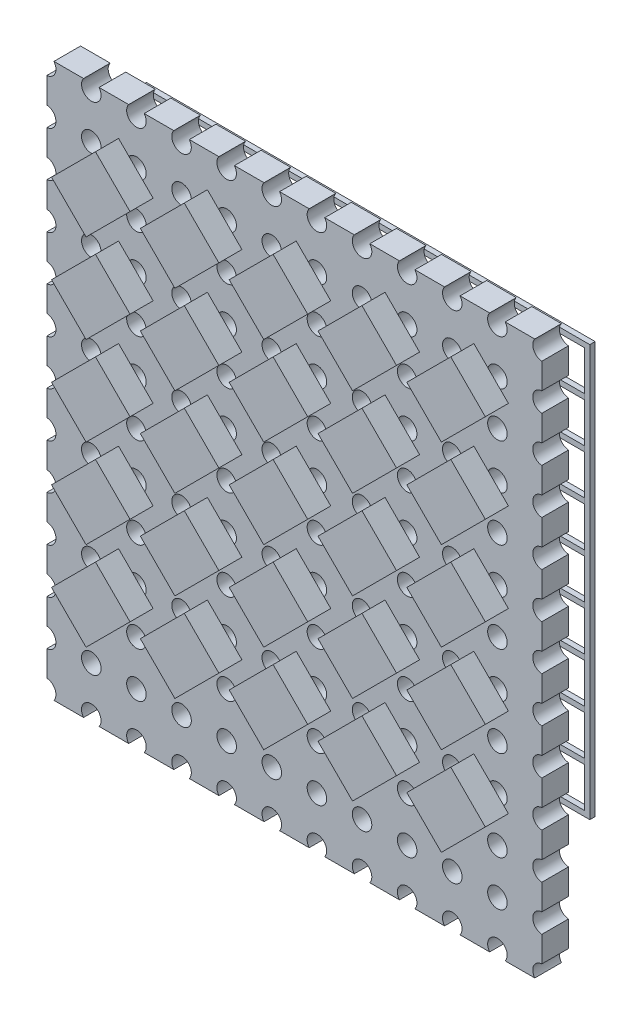
from build123d import *

# Parameters (mm, degrees)
SKETCH1_W               = 27.86
SKETCH1_H               = 31.15
BOSS_EXTRUDE1_DEPTH     = 1.5
FILL_PATTERN1_OUTLINE_R = 0.55
FILL_PATTERN1_DEPTH     = 1.5
BOSS_EXTRUDE2_DEPTH     = 1.3
LPATTERN2_COUNT         = 5
LPATTERN2_PITCH         = 5
LPATTERN2_COUNT_DIR2    = 5
LPATTERN2_PITCH_DIR2    = 5
SKETCH6_W               = 25.26
SKETCH6_H               = 23.16
SKETCH6_W_2             = 24.66
SKETCH6_H_2             = 22.56
EXTRUDE_THIN1_DEPTH     = 0.3
SKETCH6_W_3             = 24.96
SKETCH6_H_3             = 0.3
EXTRUDE_THIN1_2_DEPTH   = 0.3
EXTRUDE_THIN1_3_DEPTH   = 0.3
EXTRUDE_THIN1_4_DEPTH   = 0.3
EXTRUDE_THIN1_5_DEPTH   = 0.3
EXTRUDE_THIN1_6_DEPTH   = 0.3
EXTRUDE_THIN1_7_DEPTH   = 0.3
EXTRUDE_THIN1_8_DEPTH   = 0.3
EXTRUDE_THIN1_9_DEPTH   = 0.3


# Read off the part's stored shape, not the designer's step: Fill Pattern1
with BuildPart() as part:
    # Sketch1 → Boss-Extrude1 (new body)
    with BuildSketch(Plane.XY):
        Rectangle(SKETCH1_W, SKETCH1_H)
    extrude(amount=BOSS_EXTRUDE1_DEPTH)

    # Fill Pattern1 outline → Fill Pattern1 (cut)
    with BuildSketch(Plane.XY):
        with Locations((1.27, 0)):
            Circle(FILL_PATTERN1_OUTLINE_R)
        with Locations((-11.43, 2.54)):
            Circle(FILL_PATTERN1_OUTLINE_R)
        with BuildLine():
            ThreePointArc((-9.326205227, 15.575), (-8.89, 14.69), (-8.453794773, 15.575))
            Line((-8.453794773, 15.575), (-9.326205227, 15.575))
        make_face()
        with BuildLine():
            Line((-5.913794773, 15.575), (-6.786205227, 15.575))
            ThreePointArc((-6.786205227, 15.575), (-6.35, 14.69), (-5.913794773, 15.575))
        make_face()
        with BuildLine():
            ThreePointArc((-11.866205227, 15.575), (-11.43, 14.69), (-10.993794773, 15.575))
            Line((-10.993794773, 15.575), (-11.866205227, 15.575))
        make_face()
        with BuildLine():
            Line((-3.373794773, 15.575), (-4.246205227, 15.575))
            ThreePointArc((-4.246205227, 15.575), (-3.81, 14.69), (-3.373794773, 15.575))
        make_face()
        with BuildLine():
            ThreePointArc((-13.93, 14.691456474), (-13.468148284, 15.014955883), (-13.533794773, 15.575))
            Line((-13.533794773, 15.575), (-13.93, 15.575))
            Line((-13.93, 15.575), (-13.93, 14.691456474))
        make_face()
        with BuildLine():
            Line((-0.833794773, 15.575), (-1.706205227, 15.575))
            ThreePointArc((-1.706205227, 15.575), (-1.27, 14.69), (-0.833794773, 15.575))
        make_face()
        with BuildLine():
            ThreePointArc((-13.93, 12.151456474), (-13.42, 12.7), (-13.93, 13.248543526))
            Line((-13.93, 13.248543526), (-13.93, 12.151456474))
        make_face()
        with BuildLine():
            Line((1.706205227, 15.575), (0.833794773, 15.575))
            ThreePointArc((0.833794773, 15.575), (1.27, 14.69), (1.706205227, 15.575))
        make_face()
        with BuildLine():
            ThreePointArc((-13.93, 9.611456474), (-13.42, 10.16), (-13.93, 10.708543526))
            Line((-13.93, 10.708543526), (-13.93, 9.611456474))
        make_face()
        with BuildLine():
            Line((4.246205227, 15.575), (3.373794773, 15.575))
            ThreePointArc((3.373794773, 15.575), (3.81, 14.69), (4.246205227, 15.575))
        make_face()
        with BuildLine():
            ThreePointArc((-13.93, 7.071456474), (-13.42, 7.62), (-13.93, 8.168543526))
            Line((-13.93, 8.168543526), (-13.93, 7.071456474))
        make_face()
        with BuildLine():
            Line((6.786205227, 15.575), (5.913794773, 15.575))
            ThreePointArc((5.913794773, 15.575), (6.35, 14.69), (6.786205227, 15.575))
        make_face()
        with BuildLine():
            ThreePointArc((-13.93, 4.531456474), (-13.42, 5.08), (-13.93, 5.628543526))
            Line((-13.93, 5.628543526), (-13.93, 4.531456474))
        make_face()
        with BuildLine():
            Line((9.326205227, 15.575), (8.453794773, 15.575))
            ThreePointArc((8.453794773, 15.575), (8.89, 14.69), (9.326205227, 15.575))
        make_face()
        with BuildLine():
            ThreePointArc((-13.93, 1.991456474), (-13.42, 2.54), (-13.93, 3.088543526))
            Line((-13.93, 3.088543526), (-13.93, 1.991456474))
        make_face()
        with BuildLine():
            Line((11.866205227, 15.575), (10.993794773, 15.575))
            ThreePointArc((10.993794773, 15.575), (11.43, 14.69), (11.866205227, 15.575))
        make_face()
        with BuildLine():
            ThreePointArc((-13.93, -0.548543526), (-13.42, 0), (-13.93, 0.548543526))
            Line((-13.93, 0.548543526), (-13.93, -0.548543526))
        make_face()
        with BuildLine():
            Line((13.93, 15.575), (13.533794773, 15.575))
            ThreePointArc((13.533794773, 15.575), (13.468148284, 15.014955883), (13.93, 14.691456474))
            Line((13.93, 14.691456474), (13.93, 15.575))
        make_face()
        with BuildLine():
            ThreePointArc((-13.93, -3.088543526), (-13.42, -2.54), (-13.93, -1.991456474))
            Line((-13.93, -1.991456474), (-13.93, -3.088543526))
        make_face()
        with BuildLine():
            Line((13.93, 12.151456474), (13.93, 13.248543526))
            ThreePointArc((13.93, 13.248543526), (13.42, 12.7), (13.93, 12.151456474))
        make_face()
        with BuildLine():
            ThreePointArc((-13.93, -5.628543526), (-13.42, -5.08), (-13.93, -4.531456474))
            Line((-13.93, -4.531456474), (-13.93, -5.628543526))
        make_face()
        with BuildLine():
            Line((13.93, 9.611456474), (13.93, 10.708543526))
            ThreePointArc((13.93, 10.708543526), (13.42, 10.16), (13.93, 9.611456474))
        make_face()
        with BuildLine():
            ThreePointArc((-13.93, -8.168543526), (-13.42, -7.62), (-13.93, -7.071456474))
            Line((-13.93, -7.071456474), (-13.93, -8.168543526))
        make_face()
        with BuildLine():
            Line((13.93, 7.071456474), (13.93, 8.168543526))
            ThreePointArc((13.93, 8.168543526), (13.42, 7.62), (13.93, 7.071456474))
        make_face()
        with BuildLine():
            ThreePointArc((-13.93, -10.708543526), (-13.42, -10.16), (-13.93, -9.611456474))
            Line((-13.93, -9.611456474), (-13.93, -10.708543526))
        make_face()
        with BuildLine():
            Line((13.93, 4.531456474), (13.93, 5.628543526))
            ThreePointArc((13.93, 5.628543526), (13.42, 5.08), (13.93, 4.531456474))
        make_face()
        with BuildLine():
            ThreePointArc((-13.93, -13.248543526), (-13.42, -12.7), (-13.93, -12.151456474))
            Line((-13.93, -12.151456474), (-13.93, -13.248543526))
        make_face()
        with BuildLine():
            Line((13.93, 1.991456474), (13.93, 3.088543526))
            ThreePointArc((13.93, 3.088543526), (13.42, 2.54), (13.93, 1.991456474))
        make_face()
        with BuildLine():
            ThreePointArc((-13.533794773, -15.575), (-13.468148284, -15.014955883), (-13.93, -14.691456474))
            Line((-13.93, -14.691456474), (-13.93, -15.575))
            Line((-13.93, -15.575), (-13.533794773, -15.575))
        make_face()
        with BuildLine():
            Line((13.93, -0.548543526), (13.93, 0.548543526))
            ThreePointArc((13.93, 0.548543526), (13.42, 0), (13.93, -0.548543526))
        make_face()
        with BuildLine():
            ThreePointArc((-10.993794773, -15.575), (-11.43, -14.69), (-11.866205227, -15.575))
            Line((-11.866205227, -15.575), (-10.993794773, -15.575))
        make_face()
        with BuildLine():
            Line((13.93, -3.088543526), (13.93, -1.991456474))
            ThreePointArc((13.93, -1.991456474), (13.42, -2.54), (13.93, -3.088543526))
        make_face()
        with BuildLine():
            ThreePointArc((-8.453794773, -15.575), (-8.89, -14.69), (-9.326205227, -15.575))
            Line((-9.326205227, -15.575), (-8.453794773, -15.575))
        make_face()
        with BuildLine():
            Line((13.93, -5.628543526), (13.93, -4.531456474))
            ThreePointArc((13.93, -4.531456474), (13.42, -5.08), (13.93, -5.628543526))
        make_face()
        with BuildLine():
            ThreePointArc((-5.913794773, -15.575), (-6.35, -14.69), (-6.786205227, -15.575))
            Line((-6.786205227, -15.575), (-5.913794773, -15.575))
        make_face()
        with BuildLine():
            Line((13.93, -8.168543526), (13.93, -7.071456474))
            ThreePointArc((13.93, -7.071456474), (13.42, -7.62), (13.93, -8.168543526))
        make_face()
        with BuildLine():
            ThreePointArc((-3.373794773, -15.575), (-3.81, -14.69), (-4.246205227, -15.575))
            Line((-4.246205227, -15.575), (-3.373794773, -15.575))
        make_face()
        with BuildLine():
            Line((13.93, -10.708543526), (13.93, -9.611456474))
            ThreePointArc((13.93, -9.611456474), (13.42, -10.16), (13.93, -10.708543526))
        make_face()
        with BuildLine():
            ThreePointArc((-0.833794773, -15.575), (-1.27, -14.69), (-1.706205227, -15.575))
            Line((-1.706205227, -15.575), (-0.833794773, -15.575))
        make_face()
        with BuildLine():
            Line((13.93, -13.248543526), (13.93, -12.151456474))
            ThreePointArc((13.93, -12.151456474), (13.42, -12.7), (13.93, -13.248543526))
        make_face()
        with BuildLine():
            ThreePointArc((1.706205227, -15.575), (1.27, -14.69), (0.833794773, -15.575))
            Line((0.833794773, -15.575), (1.706205227, -15.575))
        make_face()
        with BuildLine():
            Line((13.93, -15.575), (13.93, -14.691456474))
            ThreePointArc((13.93, -14.691456474), (13.468148284, -15.014955883), (13.533794773, -15.575))
            Line((13.533794773, -15.575), (13.93, -15.575))
        make_face()
        with BuildLine():
            ThreePointArc((4.246205227, -15.575), (3.81, -14.69), (3.373794773, -15.575))
            Line((3.373794773, -15.575), (4.246205227, -15.575))
        make_face()
        with BuildLine():
            Line((10.993794773, -15.575), (11.866205227, -15.575))
            ThreePointArc((11.866205227, -15.575), (11.43, -14.69), (10.993794773, -15.575))
        make_face()
        with BuildLine():
            ThreePointArc((6.786205227, -15.575), (6.35, -14.69), (5.913794773, -15.575))
            Line((5.913794773, -15.575), (6.786205227, -15.575))
        make_face()
        with BuildLine():
            Line((8.453794773, -15.575), (9.326205227, -15.575))
            ThreePointArc((9.326205227, -15.575), (8.89, -14.69), (8.453794773, -15.575))
        make_face()
        with Locations((-11.43, 0)):
            Circle(FILL_PATTERN1_OUTLINE_R)
        with Locations((-11.43, 7.62)):
            Circle(FILL_PATTERN1_OUTLINE_R)
        with Locations((-11.43, 5.08)):
            Circle(FILL_PATTERN1_OUTLINE_R)
        with Locations((-11.43, -7.62)):
            Circle(FILL_PATTERN1_OUTLINE_R)
        with Locations((-11.43, -10.16)):
            Circle(FILL_PATTERN1_OUTLINE_R)
        with Locations((-11.43, -2.54)):
            Circle(FILL_PATTERN1_OUTLINE_R)
        with Locations((-11.43, -5.08)):
            Circle(FILL_PATTERN1_OUTLINE_R)
        with Locations((-8.89, 0)):
            Circle(FILL_PATTERN1_OUTLINE_R)
        with Locations((-6.35, 12.7)):
            Circle(FILL_PATTERN1_OUTLINE_R)
        with Locations((-8.89, -2.54)):
            Circle(FILL_PATTERN1_OUTLINE_R)
        with Locations((-8.89, 2.54)):
            Circle(FILL_PATTERN1_OUTLINE_R)
        with Locations((-3.81, 12.7)):
            Circle(FILL_PATTERN1_OUTLINE_R)
        with Locations((-8.89, -7.62)):
            Circle(FILL_PATTERN1_OUTLINE_R)
        with Locations((-11.43, 10.16)):
            Circle(FILL_PATTERN1_OUTLINE_R)
        with Locations((-8.89, 12.7)):
            Circle(FILL_PATTERN1_OUTLINE_R)
        with Locations((-8.89, -5.08)):
            Circle(FILL_PATTERN1_OUTLINE_R)
        with Locations((-11.43, 12.7)):
            Circle(FILL_PATTERN1_OUTLINE_R)
        with Locations((3.81, -12.7)):
            Circle(FILL_PATTERN1_OUTLINE_R)
        with Locations((-1.27, 0)):
            Circle(FILL_PATTERN1_OUTLINE_R)
        with Locations((6.35, 2.54)):
            Circle(FILL_PATTERN1_OUTLINE_R)
        with Locations((8.89, -5.08)):
            Circle(FILL_PATTERN1_OUTLINE_R)
        with Locations((8.89, -10.16)):
            Circle(FILL_PATTERN1_OUTLINE_R)
        with Locations((6.35, -12.7)):
            Circle(FILL_PATTERN1_OUTLINE_R)
        with Locations((6.35, -7.62)):
            Circle(FILL_PATTERN1_OUTLINE_R)
        with Locations((3.81, -10.16)):
            Circle(FILL_PATTERN1_OUTLINE_R)
        with Locations((1.27, -12.7)):
            Circle(FILL_PATTERN1_OUTLINE_R)
        with Locations((-1.27, 2.54)):
            Circle(FILL_PATTERN1_OUTLINE_R)
        with Locations((6.35, 0)):
            Circle(FILL_PATTERN1_OUTLINE_R)
        with Locations((8.89, -7.62)):
            Circle(FILL_PATTERN1_OUTLINE_R)
        with Locations((6.35, -10.16)):
            Circle(FILL_PATTERN1_OUTLINE_R)
        with Locations((11.43, -12.7)):
            Circle(FILL_PATTERN1_OUTLINE_R)
        with Locations((1.27, 5.08)):
            Circle(FILL_PATTERN1_OUTLINE_R)
        with Locations((8.89, 2.54)):
            Circle(FILL_PATTERN1_OUTLINE_R)
        with Locations((-1.27, 5.08)):
            Circle(FILL_PATTERN1_OUTLINE_R)
        with Locations((11.43, -5.08)):
            Circle(FILL_PATTERN1_OUTLINE_R)
        with Locations((6.35, 5.08)):
            Circle(FILL_PATTERN1_OUTLINE_R)
        with Locations((8.89, -2.54)):
            Circle(FILL_PATTERN1_OUTLINE_R)
        with Locations((11.43, -10.16)):
            Circle(FILL_PATTERN1_OUTLINE_R)
        with Locations((8.89, -12.7)):
            Circle(FILL_PATTERN1_OUTLINE_R)
        with Locations((3.81, 5.08)):
            Circle(FILL_PATTERN1_OUTLINE_R)
        with Locations((8.89, 0)):
            Circle(FILL_PATTERN1_OUTLINE_R)
        with Locations((11.43, -7.62)):
            Circle(FILL_PATTERN1_OUTLINE_R)
        with Locations((-3.81, -7.62)):
            Circle(FILL_PATTERN1_OUTLINE_R)
        with Locations((-6.35, -10.16)):
            Circle(FILL_PATTERN1_OUTLINE_R)
        with Locations((-8.89, -12.7)):
            Circle(FILL_PATTERN1_OUTLINE_R)
        with Locations((3.81, -2.54)):
            Circle(FILL_PATTERN1_OUTLINE_R)
        with Locations((1.27, -5.08)):
            Circle(FILL_PATTERN1_OUTLINE_R)
        with Locations((-1.27, -7.62)):
            Circle(FILL_PATTERN1_OUTLINE_R)
        with Locations((-3.81, -10.16)):
            Circle(FILL_PATTERN1_OUTLINE_R)
        with Locations((-1.27, -2.54)):
            Circle(FILL_PATTERN1_OUTLINE_R)
        with Locations((-3.81, -5.08)):
            Circle(FILL_PATTERN1_OUTLINE_R)
        with Locations((-6.35, -7.62)):
            Circle(FILL_PATTERN1_OUTLINE_R)
        with Locations((-8.89, -10.16)):
            Circle(FILL_PATTERN1_OUTLINE_R)
        with Locations((-11.43, -12.7)):
            Circle(FILL_PATTERN1_OUTLINE_R)
        with Locations((1.27, -2.54)):
            Circle(FILL_PATTERN1_OUTLINE_R)
        with Locations((-1.27, -5.08)):
            Circle(FILL_PATTERN1_OUTLINE_R)
        with Locations((3.81, 2.54)):
            Circle(FILL_PATTERN1_OUTLINE_R)
        with Locations((6.35, -5.08)):
            Circle(FILL_PATTERN1_OUTLINE_R)
        with Locations((3.81, -7.62)):
            Circle(FILL_PATTERN1_OUTLINE_R)
        with Locations((1.27, -10.16)):
            Circle(FILL_PATTERN1_OUTLINE_R)
        with Locations((-1.27, -12.7)):
            Circle(FILL_PATTERN1_OUTLINE_R)
        with Locations((1.27, 2.54)):
            Circle(FILL_PATTERN1_OUTLINE_R)
        with Locations((6.35, -2.54)):
            Circle(FILL_PATTERN1_OUTLINE_R)
        with Locations((-6.35, -12.7)):
            Circle(FILL_PATTERN1_OUTLINE_R)
        with Locations((3.81, 0)):
            Circle(FILL_PATTERN1_OUTLINE_R)
        with Locations((3.81, -5.08)):
            Circle(FILL_PATTERN1_OUTLINE_R)
        with Locations((1.27, -7.62)):
            Circle(FILL_PATTERN1_OUTLINE_R)
        with Locations((-1.27, -10.16)):
            Circle(FILL_PATTERN1_OUTLINE_R)
        with Locations((-3.81, -12.7)):
            Circle(FILL_PATTERN1_OUTLINE_R)
        with Locations((-6.35, 2.54)):
            Circle(FILL_PATTERN1_OUTLINE_R)
        with Locations((1.27, 10.16)):
            Circle(FILL_PATTERN1_OUTLINE_R)
        with Locations((-6.35, 0)):
            Circle(FILL_PATTERN1_OUTLINE_R)
        with Locations((-1.27, 10.16)):
            Circle(FILL_PATTERN1_OUTLINE_R)
        with Locations((11.43, 12.7)):
            Circle(FILL_PATTERN1_OUTLINE_R)
        with Locations((-6.35, 7.62)):
            Circle(FILL_PATTERN1_OUTLINE_R)
        with Locations((6.35, 10.16)):
            Circle(FILL_PATTERN1_OUTLINE_R)
        with Locations((-6.35, 5.08)):
            Circle(FILL_PATTERN1_OUTLINE_R)
        with Locations((3.81, 10.16)):
            Circle(FILL_PATTERN1_OUTLINE_R)
        with Locations((-8.89, 7.62)):
            Circle(FILL_PATTERN1_OUTLINE_R)
        with Locations((3.81, 12.7)):
            Circle(FILL_PATTERN1_OUTLINE_R)
        with Locations((-8.89, 10.16)):
            Circle(FILL_PATTERN1_OUTLINE_R)
        with Locations((1.27, 12.7)):
            Circle(FILL_PATTERN1_OUTLINE_R)
        with Locations((-8.89, 5.08)):
            Circle(FILL_PATTERN1_OUTLINE_R)
        with Locations((-1.27, 12.7)):
            Circle(FILL_PATTERN1_OUTLINE_R)
        with Locations((-6.35, -2.54)):
            Circle(FILL_PATTERN1_OUTLINE_R)
        with Locations((-3.81, 10.16)):
            Circle(FILL_PATTERN1_OUTLINE_R)
        with Locations((8.89, 12.7)):
            Circle(FILL_PATTERN1_OUTLINE_R)
        with Locations((-6.35, -5.08)):
            Circle(FILL_PATTERN1_OUTLINE_R)
        with Locations((-6.35, 10.16)):
            Circle(FILL_PATTERN1_OUTLINE_R)
        with Locations((6.35, 12.7)):
            Circle(FILL_PATTERN1_OUTLINE_R)
        with Locations((11.43, 2.54)):
            Circle(FILL_PATTERN1_OUTLINE_R)
        with Locations((6.35, 7.62)):
            Circle(FILL_PATTERN1_OUTLINE_R)
        with Locations((-3.81, 2.54)):
            Circle(FILL_PATTERN1_OUTLINE_R)
        with Locations((-3.81, 0)):
            Circle(FILL_PATTERN1_OUTLINE_R)
        with Locations((3.81, 7.62)):
            Circle(FILL_PATTERN1_OUTLINE_R)
        with Locations((8.89, 5.08)):
            Circle(FILL_PATTERN1_OUTLINE_R)
        with Locations((11.43, -2.54)):
            Circle(FILL_PATTERN1_OUTLINE_R)
        with Locations((-3.81, 5.08)):
            Circle(FILL_PATTERN1_OUTLINE_R)
        with Locations((8.89, 7.62)):
            Circle(FILL_PATTERN1_OUTLINE_R)
        with Locations((11.43, 0)):
            Circle(FILL_PATTERN1_OUTLINE_R)
        with Locations((-1.27, 7.62)):
            Circle(FILL_PATTERN1_OUTLINE_R)
        with Locations((11.43, 10.16)):
            Circle(FILL_PATTERN1_OUTLINE_R)
        with Locations((-3.81, 7.62)):
            Circle(FILL_PATTERN1_OUTLINE_R)
        with Locations((8.89, 10.16)):
            Circle(FILL_PATTERN1_OUTLINE_R)
        with Locations((-3.81, -2.54)):
            Circle(FILL_PATTERN1_OUTLINE_R)
        with Locations((11.43, 5.08)):
            Circle(FILL_PATTERN1_OUTLINE_R)
        with Locations((1.27, 7.62)):
            Circle(FILL_PATTERN1_OUTLINE_R)
        with Locations((11.43, 7.62)):
            Circle(FILL_PATTERN1_OUTLINE_R)
    extrude(amount=FILL_PATTERN1_DEPTH, mode=Mode.SUBTRACT)

    # Sketch3 → Boss-Extrude2 (add)
    with BuildSketch(Plane.XY.offset(1.5)):
        Polygon((-12.369708691, 11.164834957), (-9.894834957, 13.639708691), (-7.950291309, 11.695165043), (-10.425165043, 9.220291309), align=None)
    boss_extrude2 = extrude(amount=BOSS_EXTRUDE2_DEPTH)

    # LPattern2: Boss-Extrude2 5 × 5
    with Locations(*[(i * LPATTERN2_PITCH, -j * LPATTERN2_PITCH_DIR2, 0) for i in range(LPATTERN2_COUNT) for j in range(LPATTERN2_COUNT_DIR2) if (i, j) != (0, 0)]):
        add(boss_extrude2)


with BuildPart() as body_2:
    # Sketch6 → Extrude-Thin1 (new body)
    with BuildSketch(Plane.XY.offset(-2.8)):
        with Locations((0, 1.27)):
            Rectangle(SKETCH6_W, SKETCH6_H)
        with Locations((0, 1.27)):
            Rectangle(SKETCH6_W_2, SKETCH6_H_2, mode=Mode.SUBTRACT)
    extrude(amount=EXTRUDE_THIN1_DEPTH)


with BuildPart() as body_3:
    # Sketch6 → Extrude-Thin1 2 (new body)
    with BuildSketch(Plane.XY.offset(-2.8)):
        with Locations((0, 10.16)):
            Rectangle(SKETCH6_W_3, SKETCH6_H_3)
    extrude(amount=EXTRUDE_THIN1_2_DEPTH)


with BuildPart() as body_4:
    # Sketch6 → Extrude-Thin1 3 (new body)
    with BuildSketch(Plane.XY.offset(-2.8)):
        with Locations((0, 7.62)):
            Rectangle(SKETCH6_W_3, SKETCH6_H_3)
    extrude(amount=EXTRUDE_THIN1_3_DEPTH)


with BuildPart() as body_5:
    # Sketch6 → Extrude-Thin1 4 (new body)
    with BuildSketch(Plane.XY.offset(-2.8)):
        with Locations((0, 5.08)):
            Rectangle(SKETCH6_W_3, SKETCH6_H_3)
    extrude(amount=EXTRUDE_THIN1_4_DEPTH)


with BuildPart() as body_6:
    # Sketch6 → Extrude-Thin1 5 (new body)
    with BuildSketch(Plane.XY.offset(-2.8)):
        with Locations((0, 2.54)):
            Rectangle(SKETCH6_W_3, SKETCH6_H_3)
    extrude(amount=EXTRUDE_THIN1_5_DEPTH)


with BuildPart() as body_7:
    # Sketch6 → Extrude-Thin1 6 (new body)
    with BuildSketch(Plane.XY.offset(-2.8)):
        Rectangle(SKETCH6_W_3, SKETCH6_H_3)
    extrude(amount=EXTRUDE_THIN1_6_DEPTH)


with BuildPart() as body_8:
    # Sketch6 → Extrude-Thin1 7 (new body)
    with BuildSketch(Plane.XY.offset(-2.8)):
        with Locations((0, -2.54)):
            Rectangle(SKETCH6_W_3, SKETCH6_H_3)
    extrude(amount=EXTRUDE_THIN1_7_DEPTH)


with BuildPart() as body_9:
    # Sketch6 → Extrude-Thin1 8 (new body)
    with BuildSketch(Plane.XY.offset(-2.8)):
        with Locations((0, -5.08)):
            Rectangle(SKETCH6_W_3, SKETCH6_H_3)
    extrude(amount=EXTRUDE_THIN1_8_DEPTH)


with BuildPart() as body_10:
    # Sketch6 → Extrude-Thin1 9 (new body)
    with BuildSketch(Plane.XY.offset(-2.8)):
        with Locations((0, -7.62)):
            Rectangle(SKETCH6_W_3, SKETCH6_H_3)
    extrude(amount=EXTRUDE_THIN1_9_DEPTH)


solid = Compound([part.part, body_2.part, body_3.part, body_4.part, body_5.part, body_6.part, body_7.part, body_8.part, body_9.part, body_10.part])
